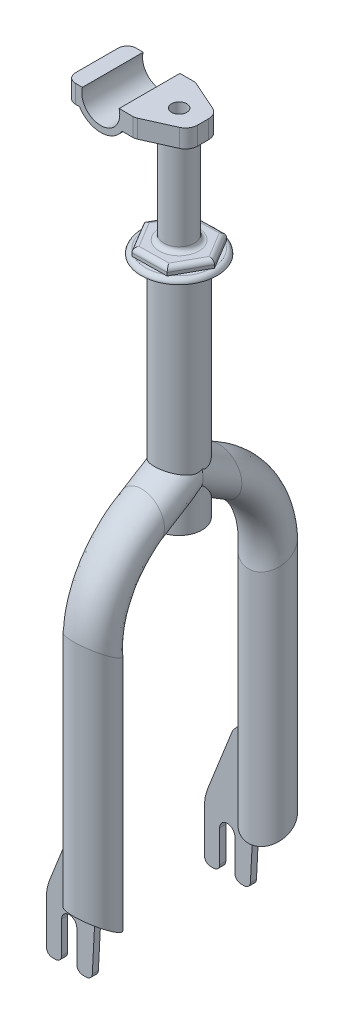
from build123d import *

# Parameters (mm, degrees)
BOSS_EXTRUDE1_DEPTH  = 20
SKETCH3_OUTSIDE_W    = 88.614
SKETCH3_OUTSIDE_H    = 38.614
CUT_EXTRUDE2_DEPTH   = 57.789083458
BOSS_EXTRUDE3_START  = 20
SKETCH4_R            = 10
BOSS_EXTRUDE3_DEPTH  = 225
SKETCH7_R            = 15
SKETCH8_R            = 15
BOSS_EXTRUDE4_DEPTH  = 150
BOSS_EXTRUDE5_DEPTH  = 4
SKETCH26_R           = 25
BOSS_EXTRUDE8_DEPTH  = 3
BOSS_EXTRUDE9_DEPTH  = 5
FILLET2_R            = 3
FILLET3_R            = 3
BOSS_EXTRUDE13_DEPTH = 2
BOSS_EXTRUDE22_DEPTH = 6
SKETCH45_R           = 12.5
CUT_EXTRUDE6_DEPTH   = 455.98513654
SKETCH46_R           = 5
CUT_EXTRUDE7_DEPTH   = 20


with BuildPart() as part:
    # Sketch2 → Boss-Extrude1 (new body)
    with BuildSketch(Plane(origin=(0, 0, 0), x_dir=(1, 0, 0), z_dir=(0, 1, 0))):
        with BuildLine():
            Line((-35, -14), (-35, 14))
            ThreePointArc((-35, 14), (-33.242640687, 18.242640687), (-29, 20))
            Line((-29, 20), (8.717414306, 20))
            ThreePointArc((8.717414306, 20), (9.971663529, 19.867440574), (11.1704919, 19.475619629))
            Line((11.1704919, 19.475619629), (30.270770125, 10.918694984))
            ThreePointArc((30.270770125, 10.918694984), (33.714393532, 7.967227328), (35, 3.617868812))
            Line((35, 3.617868812), (35, -3.617868812))
            ThreePointArc((35, -3.617868812), (33.714393532, -7.967227328), (30.270770125, -10.918694984))
            Line((30.270770125, -10.918694984), (11.1704919, -19.475619629))
            ThreePointArc((11.1704919, -19.475619629), (9.971663529, -19.867440574), (8.717414306, -20))
            Line((8.717414306, -20), (-29, -20))
            ThreePointArc((-29, -20), (-33.242640687, -18.242640687), (-35, -14))
        make_face()
    extrude(amount=BOSS_EXTRUDE1_DEPTH)

    # Sketch3 outside → Cut-Extrude2 (cut, through all)
    with BuildSketch(Plane.XY.offset(20)):
        with Locations((0, 10)):
            Rectangle(SKETCH3_OUTSIDE_W, SKETCH3_OUTSIDE_H)
        with BuildLine():
            Line((-35, 20), (-23.9, 20))
            ThreePointArc((-23.9, 20), (-12.33766892, 12.25), (-0.77533784, 20))
            Line((-0.77533784, 20), (35, 20))
            Line((35, 20), (35, 16))
            Line((35, 16), (1.651165913, 16))
            ThreePointArc((1.651165913, 16), (-12.33766892, 8.25), (-26.326503754, 16))
            Line((-26.326503754, 16), (-35, 16))
            Line((-35, 16), (-35, 20))
        make_face(mode=Mode.SUBTRACT)
    extrude(amount=-CUT_EXTRUDE2_DEPTH, mode=Mode.SUBTRACT)

    # Sketch4 → Boss-Extrude3 (add)
    with BuildSketch(Plane(origin=(0, 0, 0), x_dir=(1, 0, 0), z_dir=(0, 1, 0)).offset(BOSS_EXTRUDE3_START)):
        with Locations(Location((19.22466216, 0, 0), (0, 0, 90))):
            Circle(SKETCH4_R)
    extrude(amount=-BOSS_EXTRUDE3_DEPTH)

    # Sweep2: sweep along a path in Sketch5
    with BuildLine(Plane(origin=(20, 0, 0), x_dir=(0, 0, -1), z_dir=(1, 0, 0))) as sweep2_path:
        Line((0, -175), (-25.461532765, -190.865382102))
        ThreePointArc((-25.461532765, -190.865382102), (-48.953276731, -215.573525094), (-57.5, -248.578189703))
        Line((-57.5, -248.578189703), (-57.5, -405))
    # Sketch7 → Sweep2 (sweep)
    with BuildSketch(Plane.XY):
        with Locations((20, -175)):
            Circle(SKETCH7_R)
    sweep2 = sweep(path=sweep2_path.line)

    # Mirror1: Sweep2 across plane
    add(sweep2.mirror(Plane.XY))

    # Sketch8 → Boss-Extrude4 (add)
    with BuildSketch(Plane.XZ.offset(205)):
        with Locations(Location((19.22466216, 0, 0), (0, 0, 270))):
            Circle(SKETCH8_R)
    extrude(amount=-BOSS_EXTRUDE4_DEPTH)

    # Sketch26 → Boss-Extrude8 (add)
    with BuildSketch(Plane(origin=(0, -55, 0), x_dir=(1, 0, 0), z_dir=(0, 1, 0))):
        with Locations(Location((19.22466216, 0, 0), (0, 0, 270))):
            Circle(SKETCH26_R)
    extrude(amount=BOSS_EXTRUDE8_DEPTH)

    # Sketch29 → Boss-Extrude9 (add)
    with BuildSketch(Plane(origin=(0, -52, 0), x_dir=(1, 0, 0), z_dir=(0, 1, 0))):
        Polygon((-3.654825052, -0.371565698), (8.106703888, -20), (30.986191099, -19.628434302), (42.104149371, 0.371565698), (30.342620432, 20), (7.46313322, 19.628434302), align=None)
    extrude(amount=BOSS_EXTRUDE9_DEPTH)

    # Fillet2
    fillet2_edges = [part.edges().sort_by_distance(p)[0] for p in [
        (19.22466216, -47, 10),
        (1.904154084, -47, -9.628434302),
        (2.225939418, -47, 10.185782849),
        (19.546447493, -47, 19.814217151),
        (36.545170235, -47, 9.628434302),
        (36.223384902, -47, -10.185782849),
        (18.902876826, -47, -19.814217151),
    ]]
    fillet(fillet2_edges, radius=FILLET2_R)

    # Fillet3
    # the kernel refuses this fillet: 3 mm, written as the material it takes off along each edge
    with BuildSketch(Plane(origin=(19.22466216, -52, 0), x_dir=(0, 0, 1), z_dir=(-1, 0, 0))) as fillet3_piece_1_section:
        with BuildLine():
            CenterArc((25 - FILLET3_R, -FILLET3_R), FILLET3_R, 0, 90)
            Line((25, -FILLET3_R), (25, 0))
            Line((25, 0), (25 - FILLET3_R, 0))
        make_face()
    fillet3_piece_1 = revolve(axis=Axis((19.22466216, -52, 0), (0, 1, 0)), mode=Mode.PRIVATE)
    fillet3_piece_1 = split(fillet3_piece_1, bisect_by=Plane(origin=(25.605408513, -52.854443252, 19.715818876), z_dir=(0.016237982335695636, 0, 0.9998681552733168)), keep=Keep.TOP, mode=Mode.PRIVATE)
    add(fillet3_piece_1, mode=Mode.SUBTRACT)
    with BuildSketch(Plane(origin=(19.22466216, -52, 0), x_dir=(0, 0, 1), z_dir=(-1, 0, 0))) as fillet3_piece_2_section:
        with BuildLine():
            CenterArc((25 - FILLET3_R, -FILLET3_R), FILLET3_R, 0, 90)
            Line((25, -FILLET3_R), (25, 0))
            Line((25, 0), (25 - FILLET3_R, 0))
        make_face()
    fillet3_piece_2 = revolve(axis=Axis((19.22466216, -52, 0), (0, 1, 0)), mode=Mode.PRIVATE)
    fillet3_piece_2 = split(fillet3_piece_2, bisect_by=Plane(origin=(36.545170235, -52.854443245, 9.628434302), z_dir=(0.8740302140696237, 0, 0.48587157242774337)), keep=Keep.TOP, mode=Mode.PRIVATE)
    add(fillet3_piece_2, mode=Mode.SUBTRACT)
    with BuildSketch(Plane(origin=(19.22466216, -52, 0), x_dir=(0, 0, 1), z_dir=(-1, 0, 0))) as fillet3_piece_3_section:
        with BuildLine():
            CenterArc((25 - FILLET3_R, -FILLET3_R), FILLET3_R, 0, 90)
            Line((25, -FILLET3_R), (25, 0))
            Line((25, 0), (25 - FILLET3_R, 0))
        make_face()
    fillet3_piece_3 = revolve(axis=Axis((19.22466216, -52, 0), (0, 1, 0)), mode=Mode.PRIVATE)
    fillet3_piece_3 = split(fillet3_piece_3, bisect_by=Plane(origin=(2.225939417, -52.854443245, 10.185782848), z_dir=(-0.8577922317339283, 0, 0.5139965828455737)), keep=Keep.TOP, mode=Mode.PRIVATE)
    add(fillet3_piece_3, mode=Mode.SUBTRACT)
    with BuildSketch(Plane(origin=(19.22466216, -52, 0), x_dir=(0, 0, 1), z_dir=(-1, 0, 0))) as fillet3_piece_4_section:
        with BuildLine():
            CenterArc((25 - FILLET3_R, -FILLET3_R), FILLET3_R, 0, 90)
            Line((25, -FILLET3_R), (25, 0))
            Line((25, 0), (25 - FILLET3_R, 0))
        make_face()
    fillet3_piece_4 = revolve(axis=Axis((19.22466216, -52, 0), (0, 1, 0)), mode=Mode.PRIVATE)
    fillet3_piece_4 = split(fillet3_piece_4, bisect_by=Plane(origin=(36.223384902, -52.854443245, -10.185782849), z_dir=(0.8577922317339286, 0, -0.5139965828455736)), keep=Keep.TOP, mode=Mode.PRIVATE)
    add(fillet3_piece_4, mode=Mode.SUBTRACT)
    with BuildSketch(Plane(origin=(19.22466216, -52, 0), x_dir=(0, 0, 1), z_dir=(-1, 0, 0))) as fillet3_piece_5_section:
        with BuildLine():
            CenterArc((25 - FILLET3_R, -FILLET3_R), FILLET3_R, 0, 90)
            Line((25, -FILLET3_R), (25, 0))
            Line((25, 0), (25 - FILLET3_R, 0))
        make_face()
    fillet3_piece_5 = revolve(axis=Axis((19.22466216, -52, 0), (0, 1, 0)), mode=Mode.PRIVATE)
    fillet3_piece_5 = split(fillet3_piece_5, bisect_by=Plane(origin=(1.904154084, -52.854443245, -9.628434302), z_dir=(-0.8740302140696239, 0, -0.485871572427743)), keep=Keep.TOP, mode=Mode.PRIVATE)
    add(fillet3_piece_5, mode=Mode.SUBTRACT)
    with BuildSketch(Plane(origin=(19.22466216, -52, 0), x_dir=(0, 0, 1), z_dir=(-1, 0, 0))) as fillet3_piece_6_section:
        with BuildLine():
            CenterArc((25 - FILLET3_R, -FILLET3_R), FILLET3_R, 0, 90)
            Line((25, -FILLET3_R), (25, 0))
            Line((25, 0), (25 - FILLET3_R, 0))
        make_face()
    fillet3_piece_6 = revolve(axis=Axis((19.22466216, -52, 0), (0, 1, 0)), mode=Mode.PRIVATE)
    fillet3_piece_6 = split(fillet3_piece_6, bisect_by=Plane(origin=(18.902876826, -52.854443245, -19.814217151), z_dir=(-0.01623798233569563, 0, -0.9998681552733168)), keep=Keep.TOP, mode=Mode.PRIVATE)
    add(fillet3_piece_6, mode=Mode.SUBTRACT)

    # Sketch33 → Boss-Extrude13 (add)
    with BuildSketch(Plane(origin=(0, 20, 0), x_dir=(1, 0, 0), z_dir=(0, 1, 0))):
        with BuildLine():
            Line((-0.77533784, 20), (-0.77533784, -20))
            Line((-0.77533784, -20), (8.717414306, -20))
            ThreePointArc((8.717414306, -20), (9.971663529, -19.867440574), (11.1704919, -19.475619629))
            Line((11.1704919, -19.475619629), (30.270770125, -10.918694984))
            ThreePointArc((30.270770125, -10.918694984), (33.714393532, -7.967227328), (35, -3.617868812))
            Line((35, -3.617868812), (35, 3.617868812))
            ThreePointArc((35, 3.617868812), (33.714393532, 7.967227328), (30.270770125, 10.918694984))
            Line((30.270770125, 10.918694984), (11.1704919, 19.475619629))
            ThreePointArc((11.1704919, 19.475619629), (9.971663529, 19.867440574), (8.717414306, 20))
            Line((8.717414306, 20), (-0.77533784, 20))
        make_face()
        with BuildLine():
            Line((-23.9, -20), (-23.9, 20))
            Line((-23.9, 20), (-29, 20))
            ThreePointArc((-29, 20), (-33.242640687, 18.242640687), (-35, 14))
            Line((-35, 14), (-35, -14))
            ThreePointArc((-35, -14), (-33.242640687, -18.242640687), (-29, -20))
            Line((-29, -20), (-23.9, -20))
        make_face()
    extrude(amount=BOSS_EXTRUDE13_DEPTH)

    # Sketch44 → Boss-Extrude22 (add)
    with BuildSketch(Plane(origin=(0, 22, 0), x_dir=(1, 0, 0), z_dir=(0, 1, 0))):
        with BuildLine():
            Line((8.717414306, 20), (-29, 20))
            ThreePointArc((-29, 20), (-33.242640687, 18.242640687), (-35, 14))
            Line((-35, 14), (-35, -14))
            ThreePointArc((-35, -14), (-33.242640687, -18.242640687), (-29, -20))
            Line((-29, -20), (8.717414306, -20))
            ThreePointArc((8.717414306, -20), (9.971663529, -19.867440574), (11.1704919, -19.475619629))
            Line((11.1704919, -19.475619629), (30.270770125, -10.918694984))
            ThreePointArc((30.270770125, -10.918694984), (33.714393532, -7.967227328), (35, -3.617868812))
            Line((35, -3.617868812), (35, 3.617868812))
            ThreePointArc((35, 3.617868812), (33.714393532, 7.967227328), (30.270770125, 10.918694984))
            Line((30.270770125, 10.918694984), (11.1704919, 19.475619629))
            ThreePointArc((11.1704919, 19.475619629), (9.971663529, 19.867440574), (8.717414306, 20))
        make_face()
    extrude(amount=BOSS_EXTRUDE22_DEPTH)

    # Sketch45 → Cut-Extrude6 (cut, through all)
    with BuildSketch(Plane.XY.offset(20)):
        with Locations((-12.33766892, 24.75)):
            Circle(SKETCH45_R)
    extrude(amount=-CUT_EXTRUDE6_DEPTH, mode=Mode.SUBTRACT)

    # Sketch46 → Cut-Extrude7 (cut)
    with BuildSketch(Plane(origin=(0, 28, 0), x_dir=(1, 0, 0), z_dir=(0, 1, 0))):
        with Locations(Location((19.22466216, 0, 0), (0, 0, 270))):
            Circle(SKETCH46_R)
    extrude(amount=-CUT_EXTRUDE7_DEPTH, mode=Mode.SUBTRACT)


with BuildPart() as body_2:
    # Sketch11 → Boss-Extrude5 (new body)
    with BuildSketch(Plane.XY.offset(50)):
        with BuildLine():
            Line((8.95938616, -353.75), (5.657411933, -357.504592681))
            ThreePointArc((5.657411933, -357.504592681), (4.63852508, -358.886282592), (3.870977352, -360.421882772))
            Line((3.870977352, -360.421882772), (-11.993089327, -400.421882772))
            ThreePointArc((-11.993089327, -400.421882772), (-13.573209282, -405.851839871), (-14.106229502, -411.481857866))
            Line((-14.106229502, -411.481857866), (-14.106229502, -439.75))
            ThreePointArc((-14.106229502, -439.75), (-12.934656627, -442.578427125), (-10.106229502, -443.75))
            Line((-10.106229502, -443.75), (-8.106229502, -443.75))
            ThreePointArc((-8.106229502, -443.75), (-5.277802377, -442.578427125), (-4.106229502, -439.75))
            Line((-4.106229502, -439.75), (-4.106229502, -418.75))
            ThreePointArc((-4.106229502, -418.75), (0.893770498, -413.75), (5.893770498, -418.75))
            Line((5.893770498, -418.75), (5.893770498, -439.75))
            ThreePointArc((5.893770498, -439.75), (7.065343373, -442.578427125), (9.893770498, -443.75))
            Line((9.893770498, -443.75), (12.097912231, -443.75))
            ThreePointArc((12.097912231, -443.75), (14.851330534, -442.651497484), (16.09243037, -439.959343825))
            Line((16.09243037, -439.959343825), (17.853122704, -406.363332744))
            Line((17.853122704, -406.363332744), (8.95938616, -402.216115284))
            Line((8.95938616, -402.216115284), (8.95938616, -353.75))
        make_face()
    extrude(amount=BOSS_EXTRUDE5_DEPTH)


with BuildPart() as body_3:
    # Mirror5: mirrored copy
    add(body_2.part.mirror(Plane.XY))


solid = Compound([part.part, body_2.part, body_3.part])
